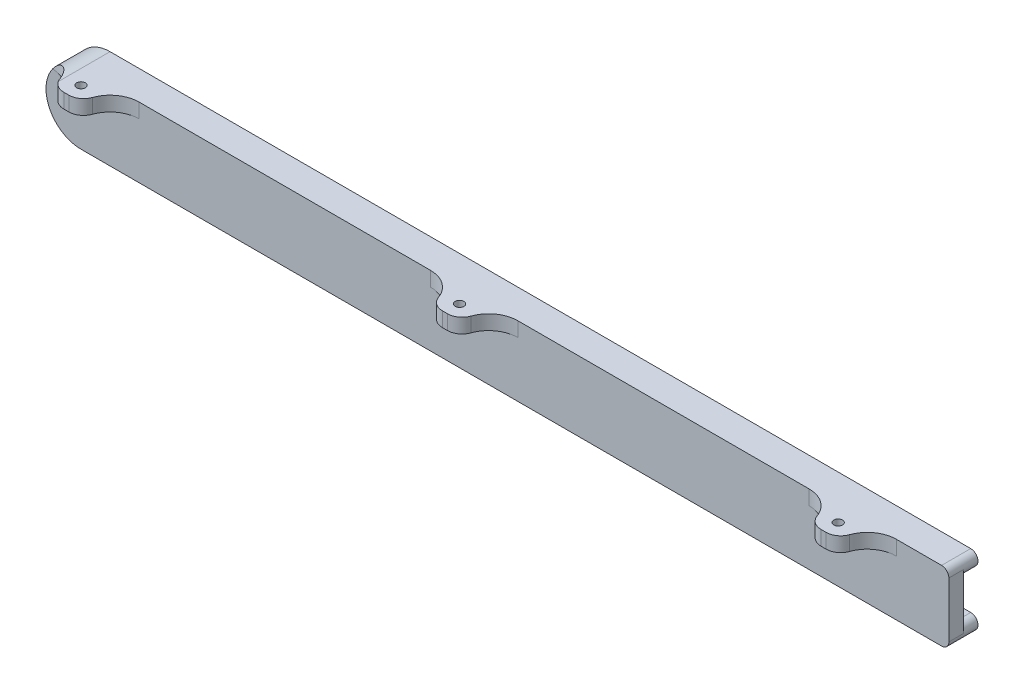
from build123d import *

# Parameters (mm, degrees)
BOSS_EXTRU_1_DEPTH = 10
BOSS_EXTRU_2_REACH = 312.393
ESQUISSE2_W        = 5
ESQUISSE2_H        = 24
CONG_1_RADIUS      = 12
CONG_1_LENGTH      = 10
BOSS_EXTRU_3_START = -19
ESQUISSE3_W        = 10
ESQUISSE3_H        = 10
ESQUISSE3_R        = 1.5
BOSS_EXTRU_3_DEPTH = 5
CONG_2_R           = 10
CONG_3_R           = 10
CONG_4_R           = 2.5
CONG_5_R           = 2.5
CONG_6_R           = 5


# Some blends are built 0.0001 mm under size
with BuildPart() as part:
    # Esquisse1 → Boss.-Extru.1 (new body)
    with BuildSketch(Plane.XY):
        Polygon((-150, 7), (-155, 7), (-155, -12), (155, -12), (155, -7), (150, -7), (-150, -7), align=None)
        Polygon((155, 12), (-155, 12), (-155, 7), (-150, 7), (150, 7), (155, 7), align=None)
    extrude(amount=BOSS_EXTRU_1_DEPTH)

    # Esquisse2 → Boss.-Extru.2 (add, up to next)
    with BuildSketch(Plane(origin=(155, 0, 0), x_dir=(0, 0, -1), z_dir=(1, 0, 0)), mode=Mode.PRIVATE) as boss_extru_2_sk1:
        with Locations((-7.5, 0)):
            Rectangle(ESQUISSE2_W, ESQUISSE2_H)
    boss_extru_2_tool1 = extrude(boss_extru_2_sk1.sketch, amount=-BOSS_EXTRU_2_REACH, mode=Mode.PRIVATE) - part.part
    add(boss_extru_2_tool1.solids().sort_by_distance((155, 0, 7.5))[0])

    # Congé1: full round fillet: the end face becomes a half cylinder, R = half its width
    cong_1_face = Plane((-155, 0, 5), x_dir=(0, 0, 1), z_dir=(-1, 0, 0))  # on the end face: x along it, z out of the body
    cong_1_slab = cong_1_face.offset(-CONG_1_RADIUS / 2) * Box(CONG_1_LENGTH, 2 * CONG_1_RADIUS, CONG_1_RADIUS, mode=Mode.PRIVATE)  # the body's end, R deep
    cong_1_round = Plane((-143, 0, 5), x_dir=(-1, 0, 0), z_dir=(0, 0, 1)) * Cylinder(CONG_1_RADIUS, CONG_1_LENGTH, mode=Mode.PRIVATE)  # its axis R under the face
    add(cong_1_slab - cong_1_round, mode=Mode.SUBTRACT)

    # Esquisse3 → Boss.-Extru.3 (add)
    # profile 1 of 3: a face of its own
    with BuildSketch(Plane.XZ.offset(12).offset(BOSS_EXTRU_3_START)):
        with Locations((-8, 15)):
            Rectangle(ESQUISSE3_W, ESQUISSE3_H)
        with Locations(Location((-8, 15, 0), (0, 0, 270))):
            Circle(ESQUISSE3_R, mode=Mode.SUBTRACT)
    # profile 2 of 3: a face of its own
    with BuildSketch(Plane.XZ.offset(12).offset(BOSS_EXTRU_3_START)):
        with Locations((-138, 15)):
            Rectangle(ESQUISSE3_W, ESQUISSE3_H)
        with Locations(Location((-138, 15, 0), (0, 0, 270))):
            Circle(ESQUISSE3_R, mode=Mode.SUBTRACT)
    # profile 3 of 3: a face of its own
    with BuildSketch(Plane.XZ.offset(12).offset(BOSS_EXTRU_3_START)):
        with Locations((122, 15)):
            Rectangle(ESQUISSE3_W, ESQUISSE3_H)
        with Locations(Location((122, 15, 0), (0, 0, 270))):
            Circle(ESQUISSE3_R, mode=Mode.SUBTRACT)
    extrude(amount=-BOSS_EXTRU_3_DEPTH)

    # Congé2
    # the kernel refuses this fillet: 10 mm, written as the material it adds along each edge
    with BuildSketch(Plane(origin=(-143, 7, 10), x_dir=(-1, 0, 0), z_dir=(0, 1, 0))) as cong_2_piece_1_section:
        with BuildLine():
            CenterArc((CONG_2_R, CONG_2_R), CONG_2_R, 180, 90)
            Line((0, CONG_2_R), (0, 0))
            Line((0, 0), (CONG_2_R, 0))
        make_face()
    cong_2_piece_1 = extrude(amount=30, mode=Mode.PRIVATE)
    cong_2_piece_1 = cong_2_piece_1 & Plane(origin=(-143, 0, 12.346007959), x_dir=(-1, 0, 0), z_dir=(0, 0, 1)) * Cylinder(12, 100, mode=Mode.PRIVATE)
    add(cong_2_piece_1)

    # Congé3
    cong_3_edges = [part.edges().sort_by_distance(p)[0] for p in [
        (127, 9.5, 10),
        (117, 9.5, 10),
        (-3, 9.5, 10),
        (-13, 9.5, 10),
        (-133, 9.5, 10),
    ]]
    fillet(cong_3_edges, radius=CONG_3_R - 0.0001)  # a hair under: the kernel refuses the full size

    # Congé4
    cong_4_edges = [part.edges().sort_by_distance(p)[0] for p in [
        (155, -12, 5),
        (155, -7, 2.5),
    ]]
    fillet(cong_4_edges, radius=CONG_4_R - 0.0001)  # a hair under: the kernel refuses the full size

    # Congé5
    cong_5_edges = [part.edges().sort_by_distance(p)[0] for p in [
        (155, 12, 5),
        (155, 7, 2.5),
    ]]
    fillet(cong_5_edges, radius=CONG_5_R - 0.0001)  # a hair under: the kernel refuses the full size

    # Congé6
    cong_6_edges = [part.edges().sort_by_distance(p)[0] for p in [
        (-143, 9.5, 20),
        (-133, 9.5, 20),
        (-13, 9.5, 20),
        (-3, 9.5, 20),
        (117, 9.5, 20),
        (127, 9.5, 20),
    ]]
    fillet(cong_6_edges, radius=CONG_6_R)


solid = part.part
